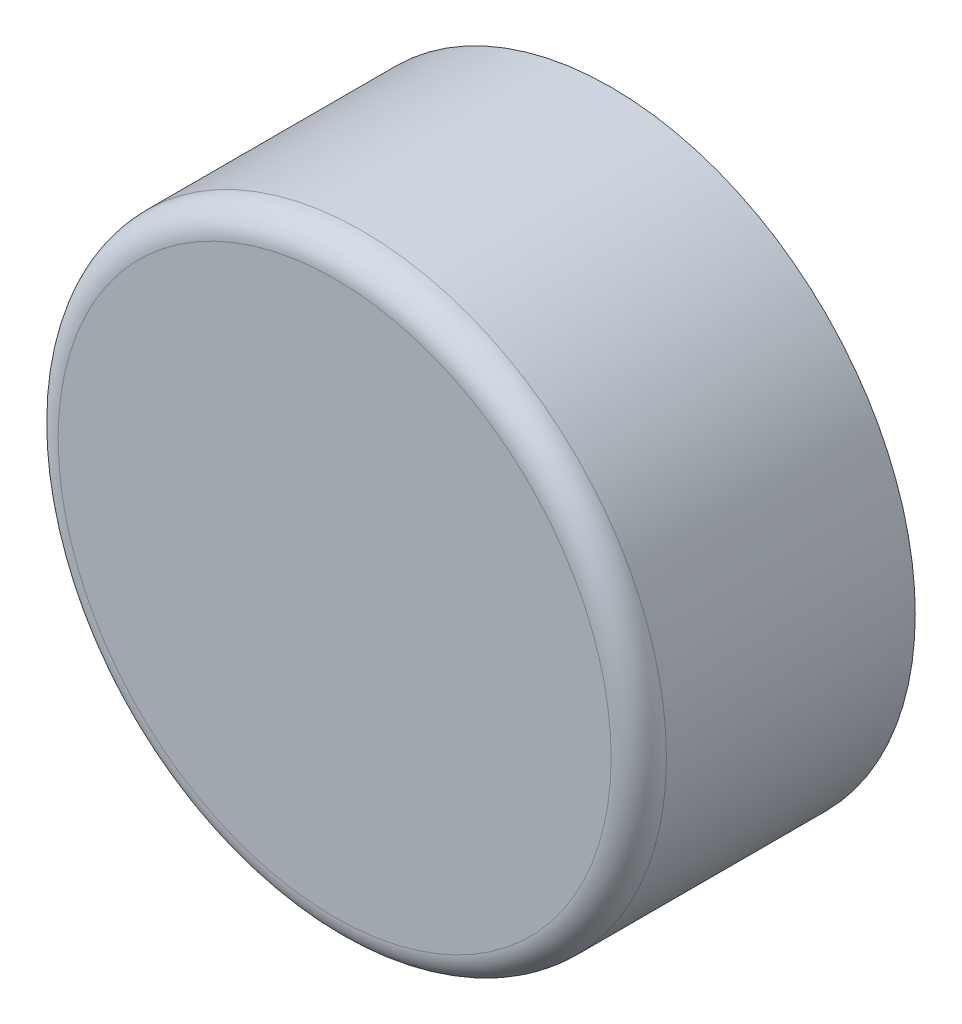
from build123d import *

# Parameters (mm, degrees)
SKETCH1_R           = 5.5
BOSS_EXTRUDE1_DEPTH = 5
FILLET1_R           = 0.5


with BuildPart() as part:
    # Sketch1 → Boss-Extrude1 (new body)
    with BuildSketch(Plane.XY):
        Circle(SKETCH1_R)
    extrude(amount=BOSS_EXTRUDE1_DEPTH)

    # Fillet1
    fillet1_edges = [part.edges().sort_by_distance(p)[0] for p in [
        (-5.5, 0, 5),
    ]]
    fillet(fillet1_edges, radius=FILLET1_R)


solid = part.part
